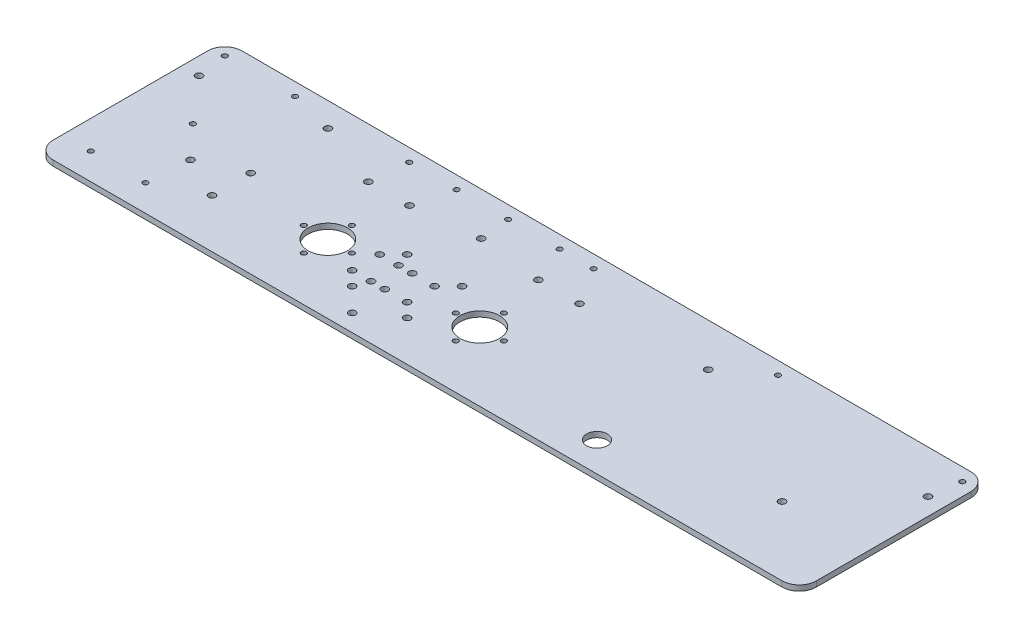
from build123d import *

# Parameters (mm, degrees)
SKETCH1_R           = 2
SKETCH1_R_2         = 1.5
SKETCH1_R_3         = 6
SKETCH1_R_4         = 11.5
BOSS_EXTRUDE1_DEPTH = 3.175
FILLET1_R           = 10
SKETCH2_R           = 2
CUT_EXTRUDE1_DEPTH  = 10
SKETCH3_R           = 2
CUT_EXTRUDE2_DEPTH  = 10
SKETCH4_R           = 1.5
SKETCH4_R_2         = 2
CUT_EXTRUDE3_DEPTH  = 6.35


with BuildPart() as part:
    # Sketch1 → Boss-Extrude1 (new body)
    with BuildSketch(Plane(origin=(0, 0, 0), x_dir=(1, 0, 0), z_dir=(0, 1, 0))):
        Polygon((-26.799577535, 0), (417.700422465, 0), (417.700422465, 17.22815868), (417.700422465, 110), (-26.799577535, 110), align=None)
        with Locations((23.200422465, 40)):
            Circle(SKETCH1_R, mode=Mode.SUBTRACT)
        with Locations((89.200422465, 40)):
            Circle(SKETCH1_R_2, mode=Mode.SUBTRACT)
        with Locations((103.200422465, 26)):
            Circle(SKETCH1_R_2, mode=Mode.SUBTRACT)
        with Locations((117.200422465, 40)):
            Circle(SKETCH1_R_2, mode=Mode.SUBTRACT)
        with Locations((177.700422465, 40)):
            Circle(SKETCH1_R_2, mode=Mode.SUBTRACT)
        with Locations((191.700422465, 26)):
            Circle(SKETCH1_R_2, mode=Mode.SUBTRACT)
        with Locations((205.700422465, 40)):
            Circle(SKETCH1_R_2, mode=Mode.SUBTRACT)
        with Locations((367.700422465, 40)):
            Circle(SKETCH1_R, mode=Mode.SUBTRACT)
        with Locations((147.450422465, 10)):
            Circle(SKETCH1_R, mode=Mode.SUBTRACT)
        with Locations((282.700422465, 17.22815868)):
            Circle(SKETCH1_R_3, mode=Mode.SUBTRACT)
        with Locations((-16.799577535, 85)):
            Circle(SKETCH1_R, mode=Mode.SUBTRACT)
        with Locations((147.450422465, 85)):
            Circle(SKETCH1_R, mode=Mode.SUBTRACT)
        with Locations((103.200422465, 54)):
            Circle(SKETCH1_R_2, mode=Mode.SUBTRACT)
        with Locations((103.200422465, 40)):
            Circle(SKETCH1_R_4, mode=Mode.SUBTRACT)
        with Locations((279.700422465, 85)):
            Circle(SKETCH1_R, mode=Mode.SUBTRACT)
        with Locations((191.700422465, 54)):
            Circle(SKETCH1_R_2, mode=Mode.SUBTRACT)
        with Locations((191.700422465, 40)):
            Circle(SKETCH1_R_4, mode=Mode.SUBTRACT)
        with Locations((407.700422465, 85)):
            Circle(SKETCH1_R, mode=Mode.SUBTRACT)
        with Locations((-19.299577535, 102.5)):
            Circle(SKETCH1_R_2, mode=Mode.SUBTRACT)
        with Locations((88.075422465, 102.5)):
            Circle(SKETCH1_R_2, mode=Mode.SUBTRACT)
        with Locations((195.450422465, 102.5)):
            Circle(SKETCH1_R_2, mode=Mode.SUBTRACT)
        with Locations((302.825422465, 102.5)):
            Circle(SKETCH1_R_2, mode=Mode.SUBTRACT)
        with Locations((410.200422465, 102.5)):
            Circle(SKETCH1_R_2, mode=Mode.SUBTRACT)
    extrude(amount=BOSS_EXTRUDE1_DEPTH)

    # Fillet1
    fillet1_edges = [part.edges().sort_by_distance(p)[0] for p in [
        (417.700422465, 1.5875, -110),
        (417.700422465, 1.5875, 0),
        (-26.799577535, 1.5875, 0),
        (-26.799577535, 1.5875, -110),
    ]]
    fillet(fillet1_edges, radius=FILLET1_R)

    # Sketch2 → Cut-Extrude1 (cut)
    with BuildSketch(Plane(origin=(0, 3.175, 0), x_dir=(1, 0, 0), z_dir=(0, 1, 0))):
        with Locations((133.950422465, 55.40559892)):
            Circle(SKETCH2_R)
        with Locations((165.950422465, 55.40559892)):
            Circle(SKETCH2_R)
        with Locations((133.950422465, 23.40559892)):
            Circle(SKETCH2_R)
        with Locations((165.950422465, 23.40559892)):
            Circle(SKETCH2_R)
        with Locations((157.950422465, 31.40559892)):
            Circle(SKETCH2_R)
        with Locations((125.950422465, 31.40559892)):
            Circle(SKETCH2_R)
        with Locations((125.950422465, 47.40559892)):
            Circle(SKETCH2_R)
        with Locations((157.950422465, 47.40559892)):
            Circle(SKETCH2_R)
    extrude(amount=-CUT_EXTRUDE1_DEPTH, mode=Mode.SUBTRACT)

    # Sketch3 → Cut-Extrude2 (cut)
    with BuildSketch(Plane.XZ):
        with Locations((136.950422465, -47.40559892)):
            Circle(SKETCH3_R)
        with Locations((144.950422465, -31.40559892)):
            Circle(SKETCH3_R)
        with Locations((136.950422465, -31.40559892)):
            Circle(SKETCH3_R)
        with Locations((144.950422465, -47.40559892)):
            Circle(SKETCH3_R)
    extrude(amount=-CUT_EXTRUDE2_DEPTH, mode=Mode.SUBTRACT)

    # Sketch4 → Cut-Extrude3 (cut)
    with BuildSketch(Plane(origin=(0, 3.175, 0), x_dir=(1, 0, 0), z_dir=(0, 1, 0))):
        with Locations((21.590660574, 102.5)):
            Circle(SKETCH4_R)
        with Locations((5.664827234, 58.95279946)):
            Circle(SKETCH4_R)
        with Locations((-10.261006106, 15.40559892)):
            Circle(SKETCH4_R)
        with Locations((47.350422465, 50.90559892)):
            Circle(SKETCH4_R_2)
        with Locations((115.670834955, 102.5)):
            Circle(SKETCH4_R)
        with Locations((145.670834955, 102.5)):
            Circle(SKETCH4_R)
        with Locations((175.670834955, 102.5)):
            Circle(SKETCH4_R)
        with Locations((47.350422465, 95.90559892)):
            Circle(SKETCH4_R_2)
        with Locations((21.590660574, 15.40559892)):
            Circle(SKETCH4_R)
        with Locations((47.350422465, 28.40559892)):
            Circle(SKETCH4_R_2)
        with Locations((208.950422465, 80.80559892)):
            Circle(SKETCH4_R_2)
        with Locations((184.950422465, 80.80559892)):
            Circle(SKETCH4_R_2)
        with Locations((109.950422465, 80.80559892)):
            Circle(SKETCH4_R_2)
        with Locations((85.950422465, 80.80559892)):
            Circle(SKETCH4_R_2)
    extrude(amount=-CUT_EXTRUDE3_DEPTH, mode=Mode.SUBTRACT)


solid = part.part
